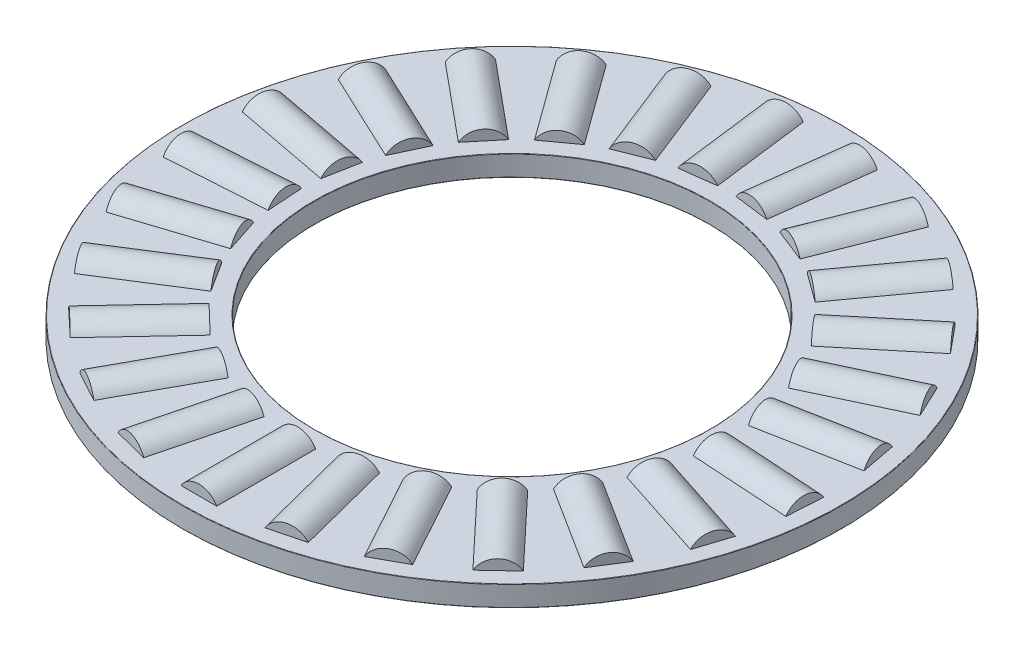
from build123d import *

# Parameters (mm, degrees)
SKETCH1_W         = 6.35
SKETCH1_H         = 0.9921875
SKETCH3_W         = 4.7625
SKETCH3_H         = 0.9921875
SKETCH2_W         = 4.7625
SKETCH2_H         = 0.9921875
CIRPATTERN1_COUNT = 25
CIRPATTERN1_ANGLE = 345.6
CIRPATTERN2_COUNT = 25
FILLET2_R         = 0.01984375


with BuildPart() as part:
    # Sketch1 → Revolve1 (revolve)
    with BuildSketch(Plane(origin=(0, 0, 0), x_dir=(0, 0, -1), z_dir=(1, 0, 0))):
        with Locations((-12.7, 0)):
            Rectangle(SKETCH1_W, SKETCH1_H)
    revolve(axis=Axis((0, -0.9921875, 0), (0, 1, 0)))

    # Sketch3 → Cut-Revolve1 (revolve, cut)
    with BuildSketch(Plane(origin=(0, 0, 0), x_dir=(0, 0, -1), z_dir=(1, 0, 0))):
        with Locations((-12.7, 0.49609375)):
            Rectangle(SKETCH3_W, SKETCH3_H)
    cut_revolve1 = revolve(axis=Axis((0, 0, 15.08125), (0, 0, -1)), mode=Mode.SUBTRACT)

    # CirPattern2: Cut-Revolve1 ×25 about axis
    cirpattern2_axis = Axis((0, 0.9921875, 0), (0, -1, 0))
    for i in range(1, CIRPATTERN2_COUNT):
        add(cut_revolve1.rotate(cirpattern2_axis, i * 360 / CIRPATTERN2_COUNT), mode=Mode.SUBTRACT)

    # Fillet2
    fillet2_edges = [part.edges().sort_by_distance(p)[0] for p in [
        (0, -0.49609375, -9.525),
        (0, 0.49609375, -9.525),
        (0, -0.49609375, -15.875),
        (0, 0.49609375, -15.875),
    ]]
    fillet(fillet2_edges, radius=FILLET2_R)


with BuildPart() as body_2:
    # Sketch2 → Revolve2 (revolve)
    with BuildSketch(Plane(origin=(0, 0, 0), x_dir=(0, 0, -1), z_dir=(1, 0, 0))):
        with Locations((-12.7, 0.49609375)):
            Rectangle(SKETCH2_W, SKETCH2_H)
    revolve(axis=Axis((0, 0, 15.08125), (0, 0, -1)))


with BuildPart() as cirpattern1_1:
    # CirPattern1: pattern copy
    add(body_2.part.rotate(Axis((0, 0.9921875, 0), (0, -1, 0)), 1 * CIRPATTERN1_ANGLE / (CIRPATTERN1_COUNT - 1)))


with BuildPart() as cirpattern1_2:
    # CirPattern1: pattern copy
    add(body_2.part.rotate(Axis((0, 0.9921875, 0), (0, -1, 0)), 2 * CIRPATTERN1_ANGLE / (CIRPATTERN1_COUNT - 1)))


with BuildPart() as cirpattern1_3:
    # CirPattern1: pattern copy
    add(body_2.part.rotate(Axis((0, 0.9921875, 0), (0, -1, 0)), 3 * CIRPATTERN1_ANGLE / (CIRPATTERN1_COUNT - 1)))


with BuildPart() as cirpattern1_4:
    # CirPattern1: pattern copy
    add(body_2.part.rotate(Axis((0, 0.9921875, 0), (0, -1, 0)), 4 * CIRPATTERN1_ANGLE / (CIRPATTERN1_COUNT - 1)))


with BuildPart() as cirpattern1_5:
    # CirPattern1: pattern copy
    add(body_2.part.rotate(Axis((0, 0.9921875, 0), (0, -1, 0)), 5 * CIRPATTERN1_ANGLE / (CIRPATTERN1_COUNT - 1)))


with BuildPart() as cirpattern1_6:
    # CirPattern1: pattern copy
    add(body_2.part.rotate(Axis((0, 0.9921875, 0), (0, -1, 0)), 6 * CIRPATTERN1_ANGLE / (CIRPATTERN1_COUNT - 1)))


with BuildPart() as cirpattern1_7:
    # CirPattern1: pattern copy
    add(body_2.part.rotate(Axis((0, 0.9921875, 0), (0, -1, 0)), 7 * CIRPATTERN1_ANGLE / (CIRPATTERN1_COUNT - 1)))


with BuildPart() as cirpattern1_8:
    # CirPattern1: pattern copy
    add(body_2.part.rotate(Axis((0, 0.9921875, 0), (0, -1, 0)), 8 * CIRPATTERN1_ANGLE / (CIRPATTERN1_COUNT - 1)))


with BuildPart() as cirpattern1_9:
    # CirPattern1: pattern copy
    add(body_2.part.rotate(Axis((0, 0.9921875, 0), (0, -1, 0)), 9 * CIRPATTERN1_ANGLE / (CIRPATTERN1_COUNT - 1)))


with BuildPart() as cirpattern1_10:
    # CirPattern1: pattern copy
    add(body_2.part.rotate(Axis((0, 0.9921875, 0), (0, -1, 0)), 10 * CIRPATTERN1_ANGLE / (CIRPATTERN1_COUNT - 1)))


with BuildPart() as cirpattern1_11:
    # CirPattern1: pattern copy
    add(body_2.part.rotate(Axis((0, 0.9921875, 0), (0, -1, 0)), 11 * CIRPATTERN1_ANGLE / (CIRPATTERN1_COUNT - 1)))


with BuildPart() as cirpattern1_12:
    # CirPattern1: pattern copy
    add(body_2.part.rotate(Axis((0, 0.9921875, 0), (0, -1, 0)), 12 * CIRPATTERN1_ANGLE / (CIRPATTERN1_COUNT - 1)))


with BuildPart() as cirpattern1_13:
    # CirPattern1: pattern copy
    add(body_2.part.rotate(Axis((0, 0.9921875, 0), (0, -1, 0)), 13 * CIRPATTERN1_ANGLE / (CIRPATTERN1_COUNT - 1)))


with BuildPart() as cirpattern1_14:
    # CirPattern1: pattern copy
    add(body_2.part.rotate(Axis((0, 0.9921875, 0), (0, -1, 0)), 14 * CIRPATTERN1_ANGLE / (CIRPATTERN1_COUNT - 1)))


with BuildPart() as cirpattern1_15:
    # CirPattern1: pattern copy
    add(body_2.part.rotate(Axis((0, 0.9921875, 0), (0, -1, 0)), 15 * CIRPATTERN1_ANGLE / (CIRPATTERN1_COUNT - 1)))


with BuildPart() as cirpattern1_16:
    # CirPattern1: pattern copy
    add(body_2.part.rotate(Axis((0, 0.9921875, 0), (0, -1, 0)), 16 * CIRPATTERN1_ANGLE / (CIRPATTERN1_COUNT - 1)))


with BuildPart() as cirpattern1_17:
    # CirPattern1: pattern copy
    add(body_2.part.rotate(Axis((0, 0.9921875, 0), (0, -1, 0)), 17 * CIRPATTERN1_ANGLE / (CIRPATTERN1_COUNT - 1)))


with BuildPart() as cirpattern1_18:
    # CirPattern1: pattern copy
    add(body_2.part.rotate(Axis((0, 0.9921875, 0), (0, -1, 0)), 18 * CIRPATTERN1_ANGLE / (CIRPATTERN1_COUNT - 1)))


with BuildPart() as cirpattern1_19:
    # CirPattern1: pattern copy
    add(body_2.part.rotate(Axis((0, 0.9921875, 0), (0, -1, 0)), 19 * CIRPATTERN1_ANGLE / (CIRPATTERN1_COUNT - 1)))


with BuildPart() as cirpattern1_20:
    # CirPattern1: pattern copy
    add(body_2.part.rotate(Axis((0, 0.9921875, 0), (0, -1, 0)), 20 * CIRPATTERN1_ANGLE / (CIRPATTERN1_COUNT - 1)))


with BuildPart() as cirpattern1_21:
    # CirPattern1: pattern copy
    add(body_2.part.rotate(Axis((0, 0.9921875, 0), (0, -1, 0)), 21 * CIRPATTERN1_ANGLE / (CIRPATTERN1_COUNT - 1)))


with BuildPart() as cirpattern1_22:
    # CirPattern1: pattern copy
    add(body_2.part.rotate(Axis((0, 0.9921875, 0), (0, -1, 0)), 22 * CIRPATTERN1_ANGLE / (CIRPATTERN1_COUNT - 1)))


with BuildPart() as cirpattern1_23:
    # CirPattern1: pattern copy
    add(body_2.part.rotate(Axis((0, 0.9921875, 0), (0, -1, 0)), 23 * CIRPATTERN1_ANGLE / (CIRPATTERN1_COUNT - 1)))


with BuildPart() as cirpattern1_24:
    # CirPattern1: pattern copy
    add(body_2.part.rotate(Axis((0, 0.9921875, 0), (0, -1, 0)), 24 * CIRPATTERN1_ANGLE / (CIRPATTERN1_COUNT - 1)))


solid = Compound([part.part, body_2.part, cirpattern1_1.part, cirpattern1_2.part, cirpattern1_3.part, cirpattern1_4.part, cirpattern1_5.part, cirpattern1_6.part, cirpattern1_7.part, cirpattern1_8.part, cirpattern1_9.part, cirpattern1_10.part, cirpattern1_11.part, cirpattern1_12.part, cirpattern1_13.part, cirpattern1_14.part, cirpattern1_15.part, cirpattern1_16.part, cirpattern1_17.part, cirpattern1_18.part, cirpattern1_19.part, cirpattern1_20.part, cirpattern1_21.part, cirpattern1_22.part, cirpattern1_23.part, cirpattern1_24.part])
